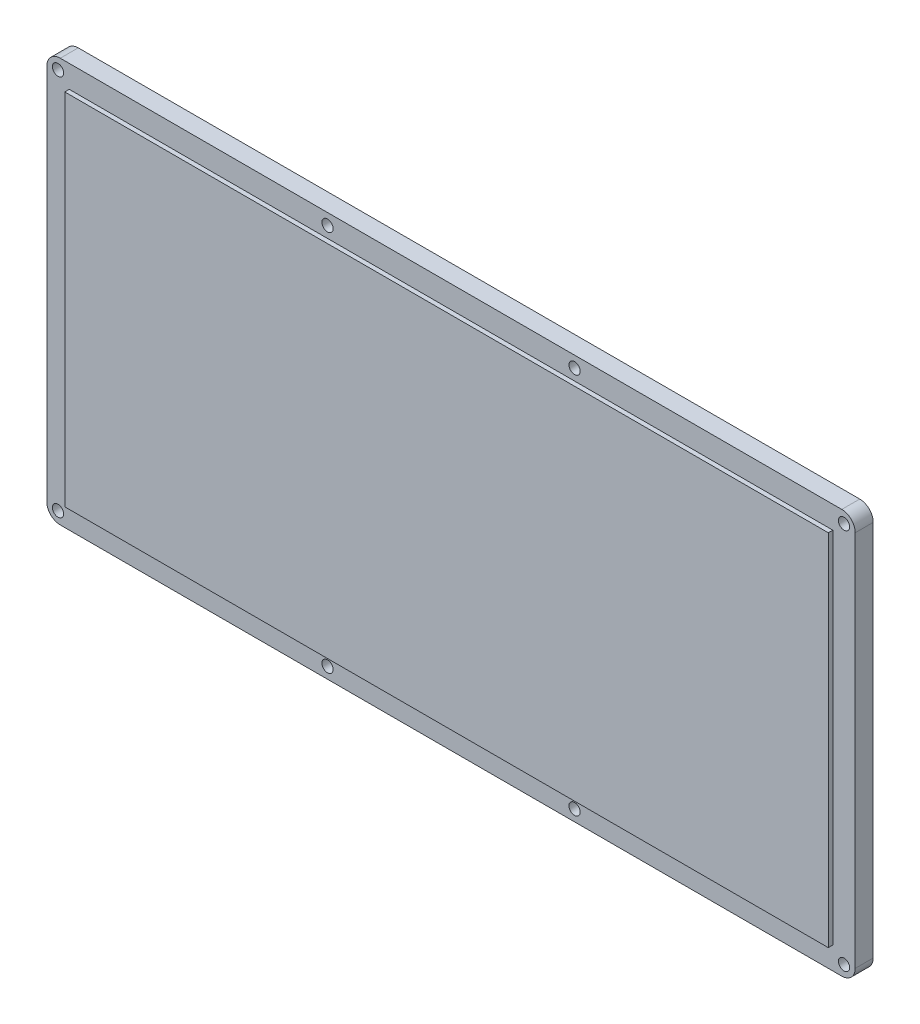
from build123d import *

# Parameters (mm, degrees)
SKETCH1_W           = 180
SKETCH1_H           = 90
BOSS_EXTRUDE1_DEPTH = 4
FILLET1_R           = 3
SKETCH2_W           = 170
SKETCH2_H           = 80
BOSS_EXTRUDE2_DEPTH = 1
SKETCH3_R           = 1.25
CUT_EXTRUDE2_DEPTH  = 10
BOSS_EXTRUDE4_DEPTH = 1


with BuildPart() as part:
    # Sketch1 → Boss-Extrude1 (new body)
    with BuildSketch(Plane.XY):
        Rectangle(SKETCH1_W, SKETCH1_H)
    extrude(amount=BOSS_EXTRUDE1_DEPTH)

    # Fillet1
    fillet1_edges = [part.edges().sort_by_distance(p)[0] for p in [
        (90, 45, 2),
        (90, -45, 2),
        (-90, -45, 2),
        (-90, 45, 2),
    ]]
    fillet(fillet1_edges, radius=FILLET1_R)

    # Sketch2 → Boss-Extrude2 (add)
    with BuildSketch(Plane.XY.offset(4)):
        Rectangle(SKETCH2_W, SKETCH2_H)
    extrude(amount=BOSS_EXTRUDE2_DEPTH)

    # Sketch3 → Cut-Extrude2 (cut)
    with BuildSketch(Plane(origin=(0, 0, 0), x_dir=(-1, 0, 0), z_dir=(0, 0, -1))):
        with Locations((-87.5, 42.5)):
            Circle(SKETCH3_R)
        with Locations((87.5, 42.5)):
            Circle(SKETCH3_R)
        with Locations((87.5, -42.5)):
            Circle(SKETCH3_R)
        with Locations((-87.5, -42.5)):
            Circle(SKETCH3_R)
        with Locations((-27.5, -42.5)):
            Circle(SKETCH3_R)
        with Locations((27.5, 42.5)):
            Circle(SKETCH3_R)
        with Locations((27.5, -42.5)):
            Circle(SKETCH3_R)
        with Locations((-27.5, 42.5)):
            Circle(SKETCH3_R)
    extrude(amount=-CUT_EXTRUDE2_DEPTH, mode=Mode.SUBTRACT)

    # Sketch4 → Boss-Extrude4 (add)
    # profile 1 of 4: a face of its own
    with BuildSketch(Plane(origin=(0, 0, 0), x_dir=(-1, 0, 0), z_dir=(0, 0, -1))):
        with BuildLine():
            add(Edge.make_bspline(
                [(71.413910742, 1.321240283), (71.413910742, 14.479292944), (60.747203687, 25.146), (47.589151025, 25.146)],
                knots=[7, 7, 7, 7, 8, 8, 8, 8], degree=3))
            Line((47.589151025, 25.146), (-47.589151025, 25.146))
            add(Edge.make_bspline(
                [(-47.589151025, 25.146), (-60.747212988, 25.146), (-71.413929346, 14.479292944), (-71.413929346, 1.321240283)],
                knots=[1, 1, 1, 1, 2, 2, 2, 2], degree=3))
            Line((-71.413929346, 1.321240283), (-71.413929346, -1.321240283))
            add(Edge.make_bspline(
                [(-71.413929346, -1.321240283), (-71.413929346, -14.479292944), (-60.747212988, -25.146), (-47.589151025, -25.146)],
                knots=[3, 3, 3, 3, 4, 4, 4, 4], degree=3))
            Line((-47.589151025, -25.146), (47.589151025, -25.146))
            add(Edge.make_bspline(
                [(47.589151025, -25.146), (60.747203687, -25.146), (71.413910742, -14.479292944), (71.413910742, -1.321240283)],
                knots=[5, 5, 5, 5, 6, 6, 6, 6], degree=3))
            Line((71.413910742, -1.321240283), (71.413910742, 1.321240283))
        make_face()
        with BuildLine():
            add(Edge.make_bspline(
                [(-22.220671582, -15.293252563), (-24.527712158, -14.433881763), (-26.450385498, -13.232969019), (-27.988114893, -11.690505029)],
                knots=[4, 4, 4, 4, 5, 5, 5, 5], degree=3))
            Line((-27.988114893, -11.690505029), (-26.793415723, -10.743102393))
            add(Edge.make_bspline(
                [(-26.793415723, -10.743102393), (-25.392775635, -12.094778027), (-23.641924365, -13.141393213), (-21.540973535, -13.883124683)],
                knots=[6, 6, 6, 6, 7, 7, 7, 7], degree=3))
            add(Edge.make_bspline(
                [(-21.540973535, -13.883124683), (-19.439948291, -14.625042188), (-17.188067139, -14.995810254), (-11.07725874, -14.995810254), (-8.166031787, -14.158410205), (-6.051332959, -12.483796143)],
                knots=[7, 7, 7, 7, 8, 8, 9.542738152, 9.542738152, 9.542738152, 9.542738152], degree=3))
            add(Edge.make_bspline(
                [(-6.051332959, -12.483796143), (-3.936820166, -10.808986743), (-2.879135889, -8.715765674), (-2.879135889, -3.545058032), (-3.785461963, -1.436944849), (-5.598095508, 0.12022522)],
                knots=[9, 9, 9, 9, 10, 10, 11.05839116, 11.05839116, 11.05839116, 11.05839116], degree=3))
            add(Edge.make_bspline(
                [(-5.598095508, 0.12022522), (-7.410729053, 1.677385986), (-9.992599365, 2.456157056), (-13.342943701, 2.456157056)],
                knots=[11, 11, 11, 11, 12, 12, 12, 12], degree=3))
            Line((-13.342943701, 2.456157056), (-15.691135254, 2.456157056))
            add(Edge.make_bspline(
                [(-15.691135254, 2.456157056), (-19.701030029, 2.456157056), (-21.705744873, 3.756096313), (-21.705744873, 7.531382153), (-21.08459209, 8.497211572), (-19.841598193, 9.254021191)],
                knots=[13, 13, 13, 13, 14, 14, 14.451898277, 14.451898277, 14.451898277, 14.451898277], degree=3))
            add(Edge.make_bspline(
                [(-19.841598193, 9.254021191), (-18.598957764, 10.01045874), (-16.734922705, 10.388668213), (-12.505525049, 10.388668213), (-10.884972803, 10.171825635), (-9.388133936, 9.738707886)],
                knots=[15, 15, 15, 15, 16, 16, 16.701523815, 16.701523815, 16.701523815, 16.701523815], degree=3))
            add(Edge.make_bspline(
                [(-9.388133936, 9.738707886), (-7.891648535, 9.305208765), (-6.655798389, 8.684465259), (-5.680564893, 7.876654102)],
                knots=[17, 17, 17, 17, 18, 18, 18, 18], degree=3))
            Line((-5.680564893, 7.876654102), (-6.854669971, 6.907290015))
            add(Edge.make_bspline(
                [(-6.854669971, 6.907290015), (-8.571253564, 8.170366406), (-11.035996143, 8.802095288), (-16.309069629, 8.802095288), (-17.819842529, 8.574267334), (-18.780862939, 8.118992798)],
                knots=[19, 19, 19, 19, 20, 20, 20.641028462, 20.641028462, 20.641028462, 20.641028462], degree=3))
            add(Edge.make_bspline(
                [(-18.780862939, 8.118992798), (-19.742181006, 7.663718262), (-20.222728418, 7.075921582), (-20.222728418, 5.518937549), (-19.886395459, 4.923876196), (-19.213413281, 4.571348877)],
                knots=[21, 21, 21, 21, 22, 22, 23.163728025, 23.163728025, 23.163728025, 23.163728025], degree=3))
            add(Edge.make_bspline(
                [(-19.213413281, 4.571348877), (-18.540765967, 4.218812256), (-17.366660889, 4.042553247), (-15.691135254, 4.042553247)],
                knots=[23, 23, 23, 23, 24, 24, 24, 24], degree=3))
            Line((-15.691135254, 4.042553247), (-13.342943701, 4.042553247))
            add(Edge.make_bspline(
                [(-13.342943701, 4.042553247), (-9.525595313, 4.042553247), (-6.580100684, 3.113205322), (-4.506478418, 1.255244312)],
                knots=[25, 25, 25, 25, 26, 26, 26, 26], degree=3))
            add(Edge.make_bspline(
                [(-4.506478418, 1.255244312), (-2.433209619, -0.603451538), (-1.396212451, -3.089597461), (-1.396212451, -7.628762256), (-1.691654883, -8.965741113), (-2.281814209, -10.214120728)],
                knots=[26, 26, 26, 26, 27, 27, 27.457591579, 27.457591579, 27.457591579, 27.457591579], degree=3))
            add(Edge.make_bspline(
                [(-2.281814209, -10.214120728), (-2.872364209, -11.46286311), (-3.7205729, -12.560851904), (-4.825751953, -13.508254541)],
                knots=[0, 0, 0, 0, 1, 1, 1, 1], degree=3))
            add(Edge.make_bspline(
                [(-4.825751953, -13.508254541), (-5.931284473, -14.456029248), (-7.342193701, -15.205025391), (-9.05859126, -15.755968506)],
                knots=[1, 1, 1, 1, 2, 2, 2, 2], degree=3))
            add(Edge.make_bspline(
                [(-9.05859126, -15.755968506), (-10.775360889, -16.306911621), (-12.683876953, -16.58239248), (-17.435233447, -16.58239248), (-19.913724023, -16.152614063), (-22.220671582, -15.293252563)],
                knots=[2, 2, 2, 2, 3, 3, 4.261526746, 4.261526746, 4.261526746, 4.261526746], degree=3))
        make_face(mode=Mode.SUBTRACT)
        with BuildLine():
            add(Edge.make_bspline(
                [(-35.073896338, 11.801456396), (-33.618468896, 10.345675488), (-32.457944385, 8.611846436), (-31.592769287, 6.600341309)],
                knots=[13, 13, 13, 13, 14, 14, 14, 14], degree=3))
            add(Edge.make_bspline(
                [(-31.592769287, 6.600341309), (-30.727705811, 4.588482715), (-30.295155469, 2.477281348), (-30.295155469, 0.266551172), (-30.295155469, -1.944532471), (-30.727705811, -4.055910571), (-31.592769287, -6.067415698)],
                knots=[14, 14, 14, 14, 15, 15, 15, 16, 16, 16, 16], degree=3))
            add(Edge.make_bspline(
                [(-31.592769287, -6.067415698), (-32.457944385, -8.079274292), (-33.618468896, -9.813094043), (-35.073896338, -11.268354053)],
                knots=[0, 0, 0, 0, 1, 1, 1, 1], degree=3))
            add(Edge.make_bspline(
                [(-35.073896338, -11.268354053), (-36.529602832, -12.724134961), (-38.263320264, -13.884482739), (-40.274843994, -14.749564819)],
                knots=[1, 1, 1, 1, 2, 2, 2, 2], degree=3))
            add(Edge.make_bspline(
                [(-40.274843994, -14.749564819), (-42.286702588, -15.614646899), (-44.397996973, -16.047187939), (-46.608727148, -16.047187939), (-48.819810791, -16.047187939), (-50.931086572, -15.614646899), (-52.942610303, -14.749564819)],
                knots=[2, 2, 2, 2, 3, 3, 3, 4, 4, 4, 4], degree=3))
            add(Edge.make_bspline(
                [(-52.942610303, -14.749564819), (-54.954468896, -13.884482739), (-56.688204932, -12.724134961), (-58.143632373, -11.268354053)],
                knots=[4, 4, 4, 4, 5, 5, 5, 5], degree=3))
            add(Edge.make_bspline(
                [(-58.143632373, -11.268354053), (-59.599320264, -9.813094043), (-60.759584326, -8.079274292), (-61.624666406, -6.067415698)],
                knots=[5, 5, 5, 5, 6, 6, 6, 6], degree=3))
            add(Edge.make_bspline(
                [(-61.624666406, -6.067415698), (-62.489748486, -4.055910571), (-62.922373242, -1.944532471), (-62.922373242, 0.266551172), (-62.922373242, 2.477281348), (-62.489748486, 4.588482715), (-61.624666406, 6.600341309)],
                knots=[6, 6, 6, 6, 7, 7, 7, 8, 8, 8, 8], degree=3))
            add(Edge.make_bspline(
                [(-61.624666406, 6.600341309), (-60.759584326, 8.611846436), (-59.599320264, 10.345675488), (-58.143632373, 11.801456396)],
                knots=[8, 8, 8, 8, 9, 9, 9, 9], degree=3))
            add(Edge.make_bspline(
                [(-58.143632373, 11.801456396), (-56.688204932, 13.256707104), (-54.954468896, 14.417231616), (-52.942610303, 15.282313696)],
                knots=[9, 9, 9, 9, 10, 10, 10, 10], degree=3))
            add(Edge.make_bspline(
                [(-52.942610303, 15.282313696), (-50.931086572, 16.147395776), (-48.819810791, 16.579936816), (-46.608727148, 16.579936816), (-44.397996973, 16.579936816), (-42.286702588, 16.147395776), (-40.274843994, 15.282313696)],
                knots=[10, 10, 10, 10, 11, 11, 11, 12, 12, 12, 12], degree=3))
            add(Edge.make_bspline(
                [(-40.274843994, 15.282313696), (-38.263320264, 14.417231616), (-36.529602832, 13.256707104), (-35.073896338, 11.801456396)],
                knots=[12, 12, 12, 12, 13, 13, 13, 13], degree=3))
        make_face(mode=Mode.SUBTRACT)
        with BuildLine():
            add(Edge.make_bspline(
                [(-7.730002588, -2.138288086), (-8.986558447, -1.190885449), (-10.857662842, -0.716988794), (-13.342943701, -0.716988794)],
                knots=[0, 0, 0, 0, 1, 1, 1, 1], degree=3))
            Line((-13.342943701, -0.716988794), (-15.691135254, -0.716988794))
            add(Edge.make_bspline(
                [(-15.691135254, -0.716988794), (-18.574866211, -0.716988794), (-20.792647119, -0.088989917), (-22.344291943, 1.167017139)],
                knots=[2, 2, 2, 2, 3, 3, 3, 3], degree=3))
            add(Edge.make_bspline(
                [(-22.344291943, 1.167017139), (-23.896197217, 2.423033496), (-24.671852197, 4.15274187), (-24.671852197, 8.412714404), (-23.758754443, 10.127716699), (-21.9323729, 11.501363086)],
                knots=[3, 3, 3, 3, 4, 4, 4.933191502, 4.933191502, 4.933191502, 4.933191502], degree=3))
            add(Edge.make_bspline(
                [(-21.9323729, 11.501363086), (-20.106158789, 12.875000171), (-17.544919775, 13.561823364), (-12.052287598, 13.561823364), (-10.002849902, 13.238512866), (-8.100770654, 12.592087207)],
                knots=[5, 5, 5, 5, 6, 6, 6.666630916, 6.666630916, 6.666630916, 6.666630916], degree=3))
            add(Edge.make_bspline(
                [(-8.100770654, 12.592087207), (-6.199063477, 11.945652246), (-4.616443799, 11.034917139), (-3.352930225, 9.859872583)],
                knots=[7, 7, 7, 7, 8, 8, 8, 8], degree=3))
            Line((-3.352930225, 9.859872583), (-4.506478418, 8.868361011))
            add(Edge.make_bspline(
                [(-4.506478418, 8.868361011), (-5.632549219, 9.852245142), (-7.047104736, 10.616310132), (-8.749586865, 11.159997876)],
                knots=[9, 9, 9, 9, 10, 10, 10, 10], degree=3))
            add(Edge.make_bspline(
                [(-8.749586865, 11.159997876), (-10.452441064, 11.703127515), (-12.285780322, 11.975250439), (-17.146841748, 11.975250439), (-19.361125195, 11.446268774), (-20.892175928, 10.388668213)],
                knots=[10, 10, 10, 10, 11, 11, 12.475725764, 12.475725764, 12.475725764, 12.475725764], degree=3))
            add(Edge.make_bspline(
                [(-20.892175928, 10.388668213), (-22.423468506, 9.331076953), (-23.188854346, 7.986842725), (-23.188854346, 4.593496362), (-22.560557812, 3.238276758), (-21.304094971, 2.290874121)],
                knots=[12, 12, 12, 12, 13, 13, 14.081162645, 14.081162645, 14.081162645, 14.081162645], degree=3))
            add(Edge.make_bspline(
                [(-21.304094971, 2.290874121), (-20.047613525, 1.343285449), (-18.17676958, 0.869584131), (-15.691135254, 0.869584131)],
                knots=[14, 14, 14, 14, 15, 15, 15, 15], degree=3))
            Line((-15.691135254, 0.869584131), (-13.425431689, 0.869584131))
            add(Edge.make_bspline(
                [(-13.425431689, 0.869584131), (-10.500475342, 0.869584131), (-8.258751709, 0.241575952), (-6.70014917, -1.014431104)],
                knots=[16, 16, 16, 16, 17, 17, 17, 17], degree=3))
            add(Edge.make_bspline(
                [(-6.70014917, -1.014431104), (-5.141714063, -2.270438159), (-4.362245361, -4.000332568), (-4.362245361, -8.260491138), (-5.275677979, -9.975502734), (-7.101724658, -11.348953784)],
                knots=[17, 17, 17, 17, 18, 18, 18.933430991, 18.933430991, 18.933430991, 18.933430991], degree=3))
            add(Edge.make_bspline(
                [(-7.101724658, -11.348953784), (-8.928292236, -12.722786206), (-11.489084766, -13.409237329), (-16.982051807, -13.409237329), (-19.031601123, -13.086298901), (-20.933308301, -12.439677905)],
                knots=[19, 19, 19, 19, 20, 20, 20.666685482, 20.666685482, 20.666685482, 20.666685482], degree=3))
            add(Edge.make_bspline(
                [(-20.933308301, -12.439677905), (-22.835387549, -11.793438281), (-24.417914209, -10.882703174), (-25.681167334, -9.707472583)],
                knots=[21, 21, 21, 21, 22, 22, 22, 22], degree=3))
            Line((-25.681167334, -9.707472583), (-24.527712158, -8.715765674))
            add(Edge.make_bspline(
                [(-24.527712158, -8.715765674), (-23.401901807, -9.700021875), (-21.987346289, -10.464086865), (-20.284510693, -11.007402539)],
                knots=[23, 23, 23, 23, 24, 24, 24, 24], degree=3))
            add(Edge.make_bspline(
                [(-20.284510693, -11.007402539), (-18.581916943, -11.551090283), (-16.748745117, -11.822655103), (-11.88751626, -11.822655103), (-9.67332583, -11.293859473), (-8.142014648, -10.236082178)],
                knots=[24, 24, 24, 24, 25, 25, 26.475271628, 26.475271628, 26.475271628, 26.475271628], degree=3))
            add(Edge.make_bspline(
                [(-8.142014648, -10.236082178), (-6.610889502, -9.178490918), (-5.84533623, -7.834256689), (-5.84533623, -4.440910327), (-6.47361416, -3.085690723), (-7.730002588, -2.138288086)],
                knots=[26, 26, 26, 26, 27, 27, 28.081162645, 28.081162645, 28.081162645, 28.081162645], degree=3))
        make_face(mode=Mode.SUBTRACT)
        with BuildLine():
            add(Edge.make_bspline(
                [(-23.435983447, 0.032184082), (-21.623368506, -1.525172021), (-19.04185166, -2.303571021), (-15.691135254, -2.303571021)],
                knots=[5, 5, 5, 5, 6, 6, 6, 6], degree=3))
            Line((-15.691135254, -2.303571021), (-13.425431689, -2.303571021))
            add(Edge.make_bspline(
                [(-13.425431689, -2.303571021), (-9.360823975, -2.303571021), (-7.3284271, -3.603500977), (-7.3284271, -7.379168188), (-7.949747314, -8.344997607), (-9.192387744, -9.101425854)],
                knots=[7, 7, 7, 7, 8, 8, 8.45203975, 8.45203975, 8.45203975, 8.45203975], degree=3))
            add(Edge.make_bspline(
                [(-9.192387744, -9.101425854), (-10.435400244, -9.858235474), (-12.29952832, -10.236082178), (-16.528907373, -10.236082178), (-18.149366602, -10.01961167), (-19.645963623, -9.586112549)],
                knots=[9, 9, 9, 9, 10, 10, 10.701758326, 10.701758326, 10.701758326, 10.701758326], degree=3))
            add(Edge.make_bspline(
                [(-19.645963623, -9.586112549), (-21.142876904, -9.152985498), (-22.378745654, -8.532241992), (-23.35360708, -7.724068066)],
                knots=[11, 11, 11, 11, 12, 12, 12, 12], degree=3))
            Line((-23.35360708, -7.724068066), (-22.179520605, -6.754694678))
            add(Edge.make_bspline(
                [(-22.179520605, -6.754694678), (-20.463104443, -8.018152441), (-17.998082813, -8.649695288), (-12.724934912, -8.649695288), (-11.214701514, -8.422053369), (-10.253234619, -7.966592798)],
                knots=[13, 13, 13, 13, 14, 14, 14.641061121, 14.641061121, 14.641061121, 14.641061121], degree=3))
            add(Edge.make_bspline(
                [(-10.253234619, -7.966592798), (-9.29227002, -7.511504297), (-8.811350537, -6.923698315), (-8.811350537, -5.366537549), (-9.148036963, -4.771476196), (-9.820684277, -4.418939575)],
                knots=[15, 15, 15, 15, 16, 16, 17.162883241, 17.162883241, 17.162883241, 17.162883241], degree=3))
            add(Edge.make_bspline(
                [(-9.820684277, -4.418939575), (-10.493666455, -4.066226221), (-11.667771533, -3.890143945), (-13.342943701, -3.890143945)],
                knots=[17, 17, 17, 17, 18, 18, 18, 18], degree=3))
            Line((-13.342943701, -3.890143945), (-15.691135254, -3.890143945))
            add(Edge.make_bspline(
                [(-15.691135254, -3.890143945), (-19.508855713, -3.890143945), (-22.454350342, -2.961168091), (-24.527712158, -1.102658276)],
                knots=[19, 19, 19, 19, 20, 20, 20, 20], degree=3))
            add(Edge.make_bspline(
                [(-24.527712158, -1.102658276), (-26.601334424, 0.755674805), (-27.637959521, 3.241634692), (-27.637959521, 7.780985522), (-27.342870557, 9.117769043), (-26.752264746, 10.366706763)],
                knots=[20, 20, 20, 20, 21, 21, 21.457394483, 21.457394483, 21.457394483, 21.457394483], degree=3))
            add(Edge.make_bspline(
                [(-26.752264746, 10.366706763), (-26.161993799, 11.615086377), (-25.313971143, 12.713437939), (-24.208438623, 13.660840576)],
                knots=[22, 22, 22, 22, 23, 23, 23, 23], degree=3))
            add(Edge.make_bspline(
                [(-24.208438623, 13.660840576), (-23.103147949, 14.60843855), (-21.692257324, 15.357611426), (-19.975487695, 15.908554541)],
                knots=[23, 23, 23, 23, 24, 24, 24, 24], degree=3))
            add(Edge.make_bspline(
                [(-19.975487695, 15.908554541), (-18.259145947, 16.459506958), (-16.350313623, 16.73479248), (-11.599217578, 16.73479248), (-9.120354932, 16.305014062), (-6.813425977, 15.445838599)],
                knots=[24, 24, 24, 24, 25, 25, 26.261302662, 26.261302662, 26.261302662, 26.261302662], degree=3))
            add(Edge.make_bspline(
                [(-6.813425977, 15.445838599), (-4.506478418, 14.586281763), (-2.584046924, 13.385369019), (-1.045982666, 11.843100366)],
                knots=[26, 26, 26, 26, 27, 27, 27, 27], degree=3))
            Line((-1.045982666, 11.843100366), (-2.240588818, 10.895502393))
            add(Edge.make_bspline(
                [(-2.240588818, 10.895502393), (-3.641396338, 12.247001294), (-5.392098779, 13.293421143), (-7.493217041, 14.035524683)],
                knots=[0, 0, 0, 0, 1, 1, 1, 1], degree=3))
            add(Edge.make_bspline(
                [(-7.493217041, 14.035524683), (-9.594149268, 14.777256152), (-11.846458301, 15.148396289), (-17.956931836, 15.148396289), (-20.868326221, 14.31099624), (-22.982839014, 12.636382178)],
                knots=[1, 1, 1, 1, 2, 2, 3.543051588, 3.543051588, 3.543051588, 3.543051588], degree=3))
            add(Edge.make_bspline(
                [(-22.982839014, 12.636382178), (-25.097612256, 10.96158208), (-26.154868652, 8.868361011), (-26.154868652, 3.697281299), (-25.248635596, 1.589168115), (-23.435983447, 0.032184082)],
                knots=[3, 3, 3, 3, 4, 4, 5.058531654, 5.058531654, 5.058531654, 5.058531654], degree=3))
        make_face(mode=Mode.SUBTRACT)
        with BuildLine():
            add(Edge.make_bspline(
                [(23.826024756, -13.080996899), (25.837548486, -12.092378174), (27.536905225, -10.739949097), (28.924150781, -9.023179468)],
                knots=[10, 10, 10, 10, 11, 11, 11, 11], degree=3))
            Line((28.924150781, -9.023179468), (30.098237256, -9.929672974))
            add(Edge.make_bspline(
                [(30.098237256, -9.929672974), (28.573902393, -11.824431738), (26.702630566, -13.317968481), (24.485296143, -14.409585571)],
                knots=[12, 12, 12, 12, 13, 13, 13, 13], degree=3))
            add(Edge.make_bspline(
                [(24.485296143, -14.409585571), (22.267422217, -15.501211963), (19.895064697, -16.047187939), (15.157456201, -16.047187939), (13.046254834, -15.614646899), (11.034731104, -14.749564819)],
                knots=[13, 13, 13, 13, 14, 14, 14.875148186, 14.875148186, 14.875148186, 14.875148186], degree=3))
            add(Edge.make_bspline(
                [(11.034731104, -14.749564819), (9.022891113, -13.884482739), (7.289062061, -12.724134961), (5.833802051, -11.268354053)],
                knots=[15, 15, 15, 15, 16, 16, 16, 16], degree=3))
            add(Edge.make_bspline(
                [(5.833802051, -11.268354053), (4.378021143, -9.813094043), (3.217850098, -8.079274292), (2.352581982, -6.067415698)],
                knots=[16, 16, 16, 16, 17, 17, 17, 17], degree=3))
            add(Edge.make_bspline(
                [(2.352581982, -6.067415698), (1.487518506, -4.055910571), (1.054968164, -1.944532471), (1.054968164, 2.477281348), (1.487518506, 4.588482715), (2.352581982, 6.600341309)],
                knots=[17, 17, 17, 17, 18, 18, 18.999840139, 18.999840139, 18.999840139, 18.999840139], degree=3))
            add(Edge.make_bspline(
                [(2.352581982, 6.600341309), (3.217850098, 8.611846436), (4.378021143, 10.345675488), (5.833802051, 11.801456396)],
                knots=[19, 19, 19, 19, 20, 20, 20, 20], degree=3))
            add(Edge.make_bspline(
                [(5.833802051, 11.801456396), (7.289062061, 13.256707104), (9.022891113, 14.417231616), (11.034731104, 15.282313696)],
                knots=[20, 20, 20, 20, 21, 21, 21, 21], degree=3))
            add(Edge.make_bspline(
                [(11.034731104, 15.282313696), (13.046254834, 16.147395776), (15.157456201, 16.579936816), (19.895064697, 16.579936816), (22.270919678, 16.034305005), (24.495565283, 14.942511182)],
                knots=[21, 21, 21, 21, 22, 22, 23.142663626, 23.142663626, 23.142663626, 23.142663626], degree=3))
            add(Edge.make_bspline(
                [(24.495565283, 14.942511182), (26.720024854, 13.850717358), (28.594440674, 12.350390332), (30.118775537, 10.441883569)],
                knots=[23, 23, 23, 23, 24, 24, 24, 24], degree=3))
            Line((30.118775537, 10.441883569), (28.924150781, 9.556095776))
            add(Edge.make_bspline(
                [(28.924150781, 9.556095776), (27.536905225, 11.27252124), (25.837548486, 12.625127051), (23.826024756, 13.613913208)],
                knots=[25, 25, 25, 25, 26, 26, 26, 26], degree=3))
            add(Edge.make_bspline(
                [(23.826024756, 13.613913208), (21.814184766, 14.602708667), (19.661739404, 15.097013379), (15.363471533, 15.097013379), (13.444704932, 14.705707031), (11.611514502, 13.922926904)],
                knots=[0, 0, 0, 0, 1, 1, 1.874354044, 1.874354044, 1.874354044, 1.874354044], degree=3))
            add(Edge.make_bspline(
                [(11.611514502, 13.922926904), (9.778175244, 13.140137476), (8.199034424, 12.086099487), (6.873924609, 10.761157104)],
                knots=[2, 2, 2, 2, 3, 3, 3, 3], degree=3))
            add(Edge.make_bspline(
                [(6.873924609, 10.761157104), (5.54862876, 9.435870557), (4.494944238, 7.856729736), (3.712164111, 6.02355791)],
                knots=[3, 3, 3, 3, 4, 4, 4, 4], degree=3))
            add(Edge.make_bspline(
                [(3.712164111, 6.02355791), (2.929365381, 4.190395386), (2.538059033, 2.271275317), (2.538059033, -1.73852644), (2.929365381, -3.657469775), (3.712164111, -5.490641602)],
                knots=[4, 4, 4, 4, 5, 5, 6.000176317, 6.000176317, 6.000176317, 6.000176317], degree=3))
            add(Edge.make_bspline(
                [(3.712164111, -5.490641602), (4.494944238, -7.323980859), (5.54862876, -8.90312168), (6.873924609, -10.228240796)],
                knots=[6, 6, 6, 6, 7, 7, 7, 7], degree=3))
            add(Edge.make_bspline(
                [(6.873924609, -10.228240796), (8.199034424, -11.553527344), (9.778175244, -12.607388599), (11.611514502, -13.390001294)],
                knots=[7, 7, 7, 7, 8, 8, 8, 8], degree=3))
            add(Edge.make_bspline(
                [(11.611514502, -13.390001294), (13.444704932, -14.172613989), (15.363471533, -14.56409707), (19.661739404, -14.56409707), (21.814184766, -14.069783057), (23.826024756, -13.080996899)],
                knots=[8, 8, 8, 8, 9, 9, 10.143701463, 10.143701463, 10.143701463, 10.143701463], degree=3))
        make_face(mode=Mode.SUBTRACT)
        with BuildLine():
            add(Edge.make_bspline(
                [(22.559385791, -10.403271973), (24.179417139, -9.607088013), (25.545938379, -8.515470923), (26.658261182, -7.12824397)],
                knots=[10, 10, 10, 10, 11, 11, 11, 11], degree=3))
            Line((26.658261182, -7.12824397), (27.770583984, -8.096324414))
            add(Edge.make_bspline(
                [(27.770583984, -8.096324414), (26.520818408, -9.648155273), (24.989860693, -10.866787866), (23.177227148, -11.752398926)],
                knots=[12, 12, 12, 12, 13, 13, 13, 13], degree=3))
            add(Edge.make_bspline(
                [(23.177227148, -11.752398926), (21.364593604, -12.638186719), (19.428414111, -13.080996899), (15.555906299, -13.080996899), (13.825742139, -12.72762312), (12.177861328, -12.020345361)],
                knots=[13, 13, 13, 13, 14, 14, 14.879972906, 14.879972906, 14.879972906, 14.879972906], degree=3))
            add(Edge.make_bspline(
                [(12.177861328, -12.020345361), (10.529999121, -11.313244336), (9.11198335, -10.365692871), (7.92448374, -9.177681665)],
                knots=[15, 15, 15, 15, 16, 16, 16, 16], degree=3))
            add(Edge.make_bspline(
                [(7.92448374, -9.177681665), (6.736463232, -7.990014624), (5.788911768, -6.571989551), (5.081978174, -4.924294775)],
                knots=[16, 16, 16, 16, 17, 17, 17, 17], degree=3))
            add(Edge.make_bspline(
                [(5.081978174, -4.924294775), (4.374542285, -3.276432568), (4.021168506, -1.546091675), (4.021168506, 2.079184717), (4.374542285, 3.809348877), (5.081978174, 5.457043652)],
                knots=[17, 17, 17, 17, 18, 18, 18.999994868, 18.999994868, 18.999994868, 18.999994868], degree=3))
            add(Edge.make_bspline(
                [(5.081978174, 5.457043652), (5.788911768, 7.105091895), (6.736463232, 8.522763501), (7.92448374, 9.710607275)],
                knots=[19, 19, 19, 19, 20, 20, 20, 20], degree=3))
            add(Edge.make_bspline(
                [(7.92448374, 9.710607275), (9.11198335, 10.898265015), (10.529999121, 11.845649048), (12.177861328, 12.553094238)],
                knots=[20, 20, 20, 20, 21, 21, 21, 21], degree=3))
            add(Edge.make_bspline(
                [(12.177861328, 12.553094238), (13.825742139, 13.260195264), (15.555906299, 13.613913208), (19.441994678, 13.613913208), (21.388424707, 13.16762417), (23.208202002, 12.275055396)],
                knots=[21, 21, 21, 21, 22, 22, 23.143890799, 23.143890799, 23.143890799, 23.143890799], degree=3))
            add(Edge.make_bspline(
                [(23.208202002, 12.275055396), (25.027439795, 11.382309888), (26.562043799, 10.153408154), (27.811827979, 8.588015332)],
                knots=[23, 23, 23, 23, 24, 24, 24, 24], degree=3))
            Line((27.811827979, 8.588015332), (26.658261182, 7.661160278))
            add(Edge.make_bspline(
                [(26.658261182, 7.661160278), (25.545938379, 9.047875635), (24.179417139, 10.139669458), (22.559385791, 10.936197583)],
                knots=[25, 25, 25, 25, 26, 26, 26, 26], degree=3))
            add(Edge.make_bspline(
                [(22.559385791, 10.936197583), (20.938833545, 11.732548975), (19.208669385, 12.130989771), (15.761903027, 12.130989771), (14.227466455, 11.818506519), (12.764913867, 11.193707446)],
                knots=[0, 0, 0, 0, 1, 1, 1.873110713, 1.873110713, 1.873110713, 1.873110713], degree=3))
            add(Edge.make_bspline(
                [(12.764913867, 11.193707446), (11.302510107, 10.568554907), (10.038996533, 9.72417854), (8.974875439, 8.660224878)],
                knots=[2, 2, 2, 2, 3, 3, 3, 3], degree=3))
            add(Edge.make_bspline(
                [(8.974875439, 8.660224878), (7.910568311, 7.595741016), (7.066005908, 6.332571606), (6.441374268, 4.870000415)],
                knots=[3, 3, 3, 3, 4, 4, 4, 4], degree=3))
            add(Edge.make_bspline(
                [(6.441374268, 4.870000415), (5.816407764, 3.407605957), (5.504091943, 1.873178687), (5.504091943, -1.340085645), (5.816407764, -2.874680347), (6.441374268, -4.337251538)],
                knots=[4, 4, 4, 4, 5, 5, 6.00000579, 6.00000579, 6.00000579, 6.00000579], degree=3))
            add(Edge.make_bspline(
                [(6.441374268, -4.337251538), (7.066005908, -5.799645996), (7.910568311, -7.063168872), (8.974875439, -8.127122534)],
                knots=[6, 6, 6, 6, 7, 7, 7, 7], degree=3))
            add(Edge.make_bspline(
                [(8.974875439, -8.127122534), (10.038996533, -9.191597095), (11.302510107, -10.036150195), (12.764913867, -10.660781836)],
                knots=[7, 7, 7, 7, 8, 8, 8, 8], degree=3))
            add(Edge.make_bspline(
                [(12.764913867, -10.660781836), (14.227466455, -11.285757642), (15.761903027, -11.597896729), (19.208669385, -11.597896729), (20.938833545, -11.199800098), (22.559385791, -10.403271973)],
                knots=[8, 8, 8, 8, 9, 9, 10.145330122, 10.145330122, 10.145330122, 10.145330122], degree=3))
        make_face(mode=Mode.SUBTRACT)
        with BuildLine():
            add(Edge.make_bspline(
                [(21.261585938, -7.73599292), (22.483706689, -7.138503809), (23.506751221, -6.318135278), (24.330775342, -5.274366431)],
                knots=[2, 2, 2, 2, 3, 3, 3, 3], degree=3))
            Line((24.330775342, -5.274366431), (25.463636426, -6.221917896))
            add(Edge.make_bspline(
                [(25.463636426, -6.221917896), (24.502336963, -7.430467383), (23.314335059, -8.381497705), (21.900133008, -9.074673999)],
                knots=[4, 4, 4, 4, 5, 5, 5, 5], degree=3))
            add(Edge.make_bspline(
                [(21.900133008, -9.074673999), (20.48557749, -9.76820376), (18.975158057, -10.114973291), (15.487184912, -10.114973291), (13.750044434, -9.651457397), (12.15734165, -8.724611646)],
                knots=[5, 5, 5, 5, 6, 6, 7.171003115, 7.171003115, 7.171003115, 7.171003115], degree=3))
            add(Edge.make_bspline(
                [(12.15734165, -8.724611646), (10.5642854, -7.79758916), (9.304566943, -6.537889307), (8.37755376, -4.944833057)],
                knots=[7, 7, 7, 7, 8, 8, 8, 8], degree=3))
            add(Edge.make_bspline(
                [(8.37755376, -4.944833057), (7.450708008, -3.35211167), (6.987201416, -1.614989795), (6.987201416, 2.147738672), (7.450708008, 3.884516382), (8.37755376, 5.477749365)],
                knots=[8, 8, 8, 8, 9, 9, 9.99981214, 9.99981214, 9.99981214, 9.99981214], degree=3))
            add(Edge.make_bspline(
                [(8.37755376, 5.477749365), (9.304566943, 7.070638184), (10.5642854, 8.330682202), (12.15734165, 9.257360522)],
                knots=[10, 10, 10, 10, 11, 11, 11, 11], degree=3))
            add(Edge.make_bspline(
                [(12.15734165, 9.257360522), (13.750044434, 10.184383008), (15.487184912, 10.6478896), (18.975158057, 10.6478896), (20.489242383, 10.300952637), (21.910383545, 9.607599609)],
                knots=[11, 11, 11, 11, 12, 12, 12.853968693, 12.853968693, 12.853968693, 12.853968693], degree=3))
            add(Edge.make_bspline(
                [(21.910383545, 9.607599609), (23.331729346, 8.914069849), (24.522875244, 7.956249243), (25.484174707, 6.734137793)],
                knots=[13, 13, 13, 13, 14, 14, 14, 14], degree=3))
            Line((25.484174707, 6.734137793), (24.310088232, 5.827997754))
            add(Edge.make_bspline(
                [(24.310088232, 5.827997754), (23.486231543, 6.871245703), (22.466647266, 7.688479541), (21.251316797, 8.279178369)],
                knots=[15, 15, 15, 15, 16, 16, 16, 16], degree=3))
            add(Edge.make_bspline(
                [(21.251316797, 8.279178369), (20.036004932, 8.869356299), (18.741683936, 9.16479873), (14.910401514, 9.16479873), (12.812929541, 8.2925729), (11.075993701, 6.548837476)],
                knots=[16, 16, 16, 16, 17, 17, 18.790153229, 18.790153229, 18.790153229, 18.790153229], degree=3))
            add(Edge.make_bspline(
                [(11.075993701, 6.548837476), (9.338685791, 4.804757886), (8.470292285, 2.710429907), (8.470292285, -2.178025195), (9.338685791, -4.27217644), (11.075993701, -6.015921167)],
                knots=[18, 18, 18, 18, 19, 19, 20.000285461, 20.000285461, 20.000285461, 20.000285461], degree=3))
            add(Edge.make_bspline(
                [(11.075993701, -6.015921167), (12.812929541, -7.760000757), (14.910401514, -8.63187312), (18.741683936, -8.63187312), (20.039297754, -8.333128564), (21.261585938, -7.73599292)],
                knots=[0, 0, 0, 0, 1, 1, 1.558611399, 1.558611399, 1.558611399, 1.558611399], degree=3))
        make_face(mode=Mode.SUBTRACT)
        with BuildLine():
            add(Edge.make_bspline(
                [(54.908304272, -13.080996899), (56.919818701, -12.092378174), (58.619184741, -10.739949097), (60.006411694, -9.023179468)],
                knots=[10, 10, 10, 10, 11, 11, 11, 11], degree=3))
            Line((60.006411694, -9.023179468), (61.180507471, -9.929672974))
            add(Edge.make_bspline(
                [(61.180507471, -9.929672974), (59.656172607, -11.824431738), (57.784900781, -13.317968481), (55.567557056, -14.409585571)],
                knots=[12, 12, 12, 12, 13, 13, 13, 13], degree=3))
            add(Edge.make_bspline(
                [(55.567557056, -14.409585571), (53.349692432, -15.501211963), (50.97732561, -16.047187939), (46.239726416, -16.047187939), (44.128525049, -15.614646899), (42.11701062, -14.749564819)],
                knots=[13, 13, 13, 13, 14, 14, 14.875144504, 14.875144504, 14.875144504, 14.875144504], degree=3))
            add(Edge.make_bspline(
                [(42.11701062, -14.749564819), (40.105152026, -13.884482739), (38.371332275, -12.724134961), (36.916072266, -11.268354053)],
                knots=[15, 15, 15, 15, 16, 16, 16, 16], degree=3))
            add(Edge.make_bspline(
                [(36.916072266, -11.268354053), (35.460291357, -9.813094043), (34.300120313, -8.079274292), (33.434852197, -6.067415698)],
                knots=[16, 16, 16, 16, 17, 17, 17, 17], degree=3))
            add(Edge.make_bspline(
                [(33.434852197, -6.067415698), (32.569788721, -4.055910571), (32.137238379, -1.944532471), (32.137238379, 2.477281348), (32.569788721, 4.588482715), (33.434852197, 6.600341309)],
                knots=[17, 17, 17, 17, 18, 18, 18.999840139, 18.999840139, 18.999840139, 18.999840139], degree=3))
            add(Edge.make_bspline(
                [(33.434852197, 6.600341309), (34.300120313, 8.611846436), (35.460291357, 10.345675488), (36.916072266, 11.801456396)],
                knots=[19, 19, 19, 19, 20, 20, 20, 20], degree=3))
            add(Edge.make_bspline(
                [(36.916072266, 11.801456396), (38.371332275, 13.256707104), (40.105152026, 14.417231616), (42.11701062, 15.282313696)],
                knots=[20, 20, 20, 20, 21, 21, 21, 21], degree=3))
            add(Edge.make_bspline(
                [(42.11701062, 15.282313696), (44.128525049, 16.147395776), (46.239726416, 16.579936816), (50.97732561, 16.579936816), (53.353171289, 16.034305005), (55.577826196, 14.942511182)],
                knots=[21, 21, 21, 21, 22, 22, 23.142668434, 23.142668434, 23.142668434, 23.142668434], degree=3))
            add(Edge.make_bspline(
                [(55.577826196, 14.942511182), (57.802295068, 13.850717358), (59.676701587, 12.350390332), (61.20103645, 10.441883569)],
                knots=[23, 23, 23, 23, 24, 24, 24, 24], degree=3))
            Line((61.20103645, 10.441883569), (60.006411694, 9.556095776))
            add(Edge.make_bspline(
                [(60.006411694, 9.556095776), (58.619184741, 11.27252124), (56.919818701, 12.625127051), (54.908304272, 13.613913208)],
                knots=[25, 25, 25, 25, 26, 26, 26, 26], degree=3))
            add(Edge.make_bspline(
                [(54.908304272, 13.613913208), (52.896445679, 14.602708667), (50.744009619, 15.097013379), (46.445732446, 15.097013379), (44.526956543, 14.705707031), (42.693794019, 13.922926904)],
                knots=[0, 0, 0, 0, 1, 1, 1.874350498, 1.874350498, 1.874350498, 1.874350498], degree=3))
            add(Edge.make_bspline(
                [(42.693794019, 13.922926904), (40.860445459, 13.140137476), (39.281304639, 12.086099487), (37.956194824, 10.761157104)],
                knots=[2, 2, 2, 2, 3, 3, 3, 3], degree=3))
            add(Edge.make_bspline(
                [(37.956194824, 10.761157104), (36.630898975, 9.435870557), (35.577214453, 7.856729736), (34.794434326, 6.02355791)],
                knots=[3, 3, 3, 3, 4, 4, 4, 4], degree=3))
            add(Edge.make_bspline(
                [(34.794434326, 6.02355791), (34.011635596, 4.190395386), (33.620329248, 2.271275317), (33.620329248, -1.73852644), (34.011635596, -3.657469775), (34.794434326, -5.490641602)],
                knots=[4, 4, 4, 4, 5, 5, 6.000176317, 6.000176317, 6.000176317, 6.000176317], degree=3))
            add(Edge.make_bspline(
                [(34.794434326, -5.490641602), (35.577214453, -7.323980859), (36.630898975, -8.90312168), (37.956194824, -10.228240796)],
                knots=[6, 6, 6, 6, 7, 7, 7, 7], degree=3))
            add(Edge.make_bspline(
                [(37.956194824, -10.228240796), (39.281304639, -11.553527344), (40.860445459, -12.607388599), (42.693794019, -13.390001294)],
                knots=[7, 7, 7, 7, 8, 8, 8, 8], degree=3))
            add(Edge.make_bspline(
                [(42.693794019, -13.390001294), (44.526956543, -14.172613989), (46.445732446, -14.56409707), (50.744009619, -14.56409707), (52.896445679, -14.069783057), (54.908304272, -13.080996899)],
                knots=[8, 8, 8, 8, 9, 9, 10.143706102, 10.143706102, 10.143706102, 10.143706102], degree=3))
        make_face(mode=Mode.SUBTRACT)
        with BuildLine():
            add(Edge.make_bspline(
                [(53.641646704, -10.403271973), (55.261678052, -9.607088013), (56.628208594, -8.515470923), (57.740531396, -7.12824397)],
                knots=[10, 10, 10, 10, 11, 11, 11, 11], degree=3))
            Line((57.740531396, -7.12824397), (58.852854199, -8.096324414))
            add(Edge.make_bspline(
                [(58.852854199, -8.096324414), (57.603079321, -9.648155273), (56.072130908, -10.866787866), (54.259497363, -11.752398926)],
                knots=[12, 12, 12, 12, 13, 13, 13, 13], degree=3))
            add(Edge.make_bspline(
                [(54.259497363, -11.752398926), (52.446854517, -12.638186719), (50.510684326, -13.080996899), (46.638167212, -13.080996899), (44.908003052, -12.72762312), (43.260131543, -12.020345361)],
                knots=[13, 13, 13, 13, 14, 14, 14.879968932, 14.879968932, 14.879968932, 14.879968932], degree=3))
            add(Edge.make_bspline(
                [(43.260131543, -12.020345361), (41.612260034, -11.313244336), (40.194234961, -10.365692871), (39.006753955, -9.177681665)],
                knots=[15, 15, 15, 15, 16, 16, 16, 16], degree=3))
            add(Edge.make_bspline(
                [(39.006753955, -9.177681665), (37.818733447, -7.990014624), (36.871181982, -6.571989551), (36.164248389, -4.924294775)],
                knots=[16, 16, 16, 16, 17, 17, 17, 17], degree=3))
            add(Edge.make_bspline(
                [(36.164248389, -4.924294775), (35.4568125, -3.276432568), (35.103438721, -1.546091675), (35.103438721, 2.079184717), (35.4568125, 3.809348877), (36.164248389, 5.457043652)],
                knots=[17, 17, 17, 17, 18, 18, 18.999994868, 18.999994868, 18.999994868, 18.999994868], degree=3))
            add(Edge.make_bspline(
                [(36.164248389, 5.457043652), (36.871181982, 7.105091895), (37.818733447, 8.522763501), (39.006753955, 9.710607275)],
                knots=[19, 19, 19, 19, 20, 20, 20, 20], degree=3))
            add(Edge.make_bspline(
                [(39.006753955, 9.710607275), (40.194234961, 10.898265015), (41.612260034, 11.845649048), (43.260131543, 12.553094238)],
                knots=[20, 20, 20, 20, 21, 21, 21, 21], degree=3))
            add(Edge.make_bspline(
                [(43.260131543, 12.553094238), (44.908003052, 13.260195264), (46.638167212, 13.613913208), (50.524255591, 13.613913208), (52.470694922, 13.16762417), (54.290462915, 12.275055396)],
                knots=[21, 21, 21, 21, 22, 22, 23.143890799, 23.143890799, 23.143890799, 23.143890799], degree=3))
            add(Edge.make_bspline(
                [(54.290462915, 12.275055396), (56.10971001, 11.382309888), (57.644314014, 10.153408154), (58.894088892, 8.588015332)],
                knots=[23, 23, 23, 23, 24, 24, 24, 24], degree=3))
            Line((58.894088892, 8.588015332), (57.740531396, 7.661160278))
            add(Edge.make_bspline(
                [(57.740531396, 7.661160278), (56.628208594, 9.047875635), (55.261678052, 10.139669458), (53.641646704, 10.936197583)],
                knots=[25, 25, 25, 25, 26, 26, 26, 26], degree=3))
            add(Edge.make_bspline(
                [(53.641646704, 10.936197583), (52.02110376, 11.732548975), (50.290930298, 12.130989771), (46.844173242, 12.130989771), (45.309745972, 11.818506519), (43.84717478, 11.193707446)],
                knots=[0, 0, 0, 0, 1, 1, 1.873105659, 1.873105659, 1.873105659, 1.873105659], degree=3))
            add(Edge.make_bspline(
                [(43.84717478, 11.193707446), (42.384780322, 10.568554907), (41.121257446, 9.72417854), (40.057136353, 8.660224878)],
                knots=[2, 2, 2, 2, 3, 3, 3, 3], degree=3))
            add(Edge.make_bspline(
                [(40.057136353, 8.660224878), (38.992829224, 7.595741016), (38.148276123, 6.332571606), (37.523644482, 4.870000415)],
                knots=[3, 3, 3, 3, 4, 4, 4, 4], degree=3))
            add(Edge.make_bspline(
                [(37.523644482, 4.870000415), (36.898677979, 3.407605957), (36.586362158, 1.873178687), (36.586362158, -1.340085645), (36.898677979, -2.874680347), (37.523644482, -4.337251538)],
                knots=[4, 4, 4, 4, 5, 5, 6.00000579, 6.00000579, 6.00000579, 6.00000579], degree=3))
            add(Edge.make_bspline(
                [(37.523644482, -4.337251538), (38.148276123, -5.799645996), (38.992829224, -7.063168872), (40.057136353, -8.127122534)],
                knots=[6, 6, 6, 6, 7, 7, 7, 7], degree=3))
            add(Edge.make_bspline(
                [(40.057136353, -8.127122534), (41.121257446, -9.191597095), (42.384780322, -10.036150195), (43.84717478, -10.660781836)],
                knots=[7, 7, 7, 7, 8, 8, 8, 8], degree=3))
            add(Edge.make_bspline(
                [(43.84717478, -10.660781836), (45.309745972, -11.285757642), (46.844173242, -11.597896729), (50.290930298, -11.597896729), (52.02110376, -11.199800098), (53.641646704, -10.403271973)],
                knots=[8, 8, 8, 8, 9, 9, 10.145336753, 10.145336753, 10.145336753, 10.145336753], degree=3))
        make_face(mode=Mode.SUBTRACT)
        with BuildLine():
            add(Edge.make_bspline(
                [(52.343856152, -7.73599292), (53.565967603, -7.138503809), (54.589030737, -6.318135278), (55.413054858, -5.274366431)],
                knots=[2, 2, 2, 2, 3, 3, 3, 3], degree=3))
            Line((55.413054858, -5.274366431), (56.545906641, -6.221917896))
            add(Edge.make_bspline(
                [(56.545906641, -6.221917896), (55.584607178, -7.430467383), (54.396595972, -8.381497705), (52.982403223, -9.074673999)],
                knots=[4, 4, 4, 4, 5, 5, 5, 5], degree=3))
            add(Edge.make_bspline(
                [(52.982403223, -9.074673999), (51.567857007, -9.76820376), (50.057437573, -10.114973291), (46.569436523, -10.114973291), (44.832314648, -9.651457397), (43.239602563, -8.724611646)],
                knots=[5, 5, 5, 5, 6, 6, 7.170995345, 7.170995345, 7.170995345, 7.170995345], degree=3))
            add(Edge.make_bspline(
                [(43.239602563, -8.724611646), (41.646537012, -7.79758916), (40.38684646, -6.537889307), (39.459823975, -4.944833057)],
                knots=[7, 7, 7, 7, 8, 8, 8, 8], degree=3))
            add(Edge.make_bspline(
                [(39.459823975, -4.944833057), (38.532959619, -3.35211167), (38.069471631, -1.614989795), (38.069471631, 2.147738672), (38.532959619, 3.884516382), (39.459823975, 5.477749365)],
                knots=[8, 8, 8, 8, 9, 9, 9.99981214, 9.99981214, 9.99981214, 9.99981214], degree=3))
            add(Edge.make_bspline(
                [(39.459823975, 5.477749365), (40.38684646, 7.070638184), (41.646537012, 8.330682202), (43.239602563, 9.257360522)],
                knots=[10, 10, 10, 10, 11, 11, 11, 11], degree=3))
            add(Edge.make_bspline(
                [(43.239602563, 9.257360522), (44.832314648, 10.184383008), (46.569436523, 10.6478896), (50.057437573, 10.6478896), (51.571503296, 10.300952637), (52.992663062, 9.607599609)],
                knots=[11, 11, 11, 11, 12, 12, 12.85397436, 12.85397436, 12.85397436, 12.85397436], degree=3))
            add(Edge.make_bspline(
                [(52.992663062, 9.607599609), (54.413999561, 8.914069849), (55.605136157, 7.956249243), (56.56643562, 6.734137793)],
                knots=[13, 13, 13, 13, 14, 14, 14, 14], degree=3))
            Line((56.56643562, 6.734137793), (55.392349146, 5.827997754))
            add(Edge.make_bspline(
                [(55.392349146, 5.827997754), (54.568501758, 6.871245703), (53.54891748, 7.688479541), (52.333587012, 8.279178369)],
                knots=[15, 15, 15, 15, 16, 16, 16, 16], degree=3))
            add(Edge.make_bspline(
                [(52.333587012, 8.279178369), (51.118256543, 8.869356299), (49.823944849, 9.16479873), (45.992662427, 9.16479873), (43.895199756, 8.2925729), (42.158245313, 6.548837476)],
                knots=[16, 16, 16, 16, 17, 17, 18.790153229, 18.790153229, 18.790153229, 18.790153229], degree=3))
            add(Edge.make_bspline(
                [(42.158245313, 6.548837476), (40.420946704, 4.804757886), (39.5525625, 2.710429907), (39.5525625, -2.178025195), (40.420946704, -4.27217644), (42.158245313, -6.015921167)],
                knots=[18, 18, 18, 18, 19, 19, 20.000285461, 20.000285461, 20.000285461, 20.000285461], degree=3))
            add(Edge.make_bspline(
                [(42.158245313, -6.015921167), (43.895199756, -7.760000757), (45.992662427, -8.63187312), (49.823944849, -8.63187312), (51.121567969, -8.333128564), (52.343856152, -7.73599292)],
                knots=[0, 0, 0, 0, 1, 1, 1.558611399, 1.558611399, 1.558611399, 1.558611399], degree=3))
        make_face(mode=Mode.SUBTRACT)
    # profile 2 of 4: a face of its own
    with BuildSketch(Plane(origin=(0, 0, 0), x_dir=(-1, 0, 0), z_dir=(0, 0, -1))):
        with BuildLine():
            add(Edge.make_bspline(
                [(-32.952258398, -5.490641602), (-32.169552686, -3.657469775), (-31.778171924, -1.73852644), (-31.778171924, 0.266551172), (-31.778171924, 2.271275317), (-32.169552686, 4.190395386), (-32.952258398, 6.02355791)],
                knots=[13, 13, 13, 13, 14, 14, 14, 15, 15, 15, 15], degree=3))
            add(Edge.make_bspline(
                [(-32.952258398, 6.02355791), (-33.735038525, 7.856729736), (-34.789076514, 9.435870557), (-36.114111914, 10.761157104)],
                knots=[15, 15, 15, 15, 16, 16, 16, 16], degree=3))
            add(Edge.make_bspline(
                [(-36.114111914, 10.761157104), (-37.439407764, 12.086099487), (-39.018362549, 13.140137476), (-40.851627393, 13.922926904)],
                knots=[0, 0, 0, 0, 1, 1, 1, 1], degree=3))
            add(Edge.make_bspline(
                [(-40.851627393, 13.922926904), (-42.684780615, 14.705707031), (-44.603993701, 15.097013379), (-46.608727148, 15.097013379), (-48.613795459, 15.097013379), (-50.532655078, 14.705707031), (-52.365901318, 13.922926904)],
                knots=[1, 1, 1, 1, 2, 2, 2, 3, 3, 3, 3], degree=3))
            add(Edge.make_bspline(
                [(-52.365901318, 13.922926904), (-54.199091748, 13.140137476), (-55.778381396, 12.086099487), (-57.1034354, 10.761157104)],
                knots=[3, 3, 3, 3, 4, 4, 4, 4], degree=3))
            add(Edge.make_bspline(
                [(-57.1034354, 10.761157104), (-58.428787061, 9.435870557), (-59.482490186, 7.856729736), (-60.265177295, 6.02355791)],
                knots=[4, 4, 4, 4, 5, 5, 5, 5], degree=3))
            add(Edge.make_bspline(
                [(-60.265177295, 6.02355791), (-61.047883008, 4.190395386), (-61.439282373, 2.271275317), (-61.439282373, 0.266551172), (-61.439282373, -1.73852644), (-61.047883008, -3.657469775), (-60.265177295, -5.490641602)],
                knots=[5, 5, 5, 5, 6, 6, 6, 7, 7, 7, 7], degree=3))
            add(Edge.make_bspline(
                [(-60.265177295, -5.490641602), (-59.482490186, -7.323980859), (-58.428787061, -8.90312168), (-57.1034354, -10.228240796)],
                knots=[7, 7, 7, 7, 8, 8, 8, 8], degree=3))
            add(Edge.make_bspline(
                [(-57.1034354, -10.228240796), (-55.778381396, -11.553527344), (-54.199091748, -12.607388599), (-52.365901318, -13.390001294)],
                knots=[8, 8, 8, 8, 9, 9, 9, 9], degree=3))
            add(Edge.make_bspline(
                [(-52.365901318, -13.390001294), (-50.532655078, -14.172613989), (-48.613795459, -14.56409707), (-46.608727148, -14.56409707), (-44.603993701, -14.56409707), (-42.684780615, -14.172613989), (-40.851627393, -13.390001294)],
                knots=[9, 9, 9, 9, 10, 10, 10, 11, 11, 11, 11], degree=3))
            add(Edge.make_bspline(
                [(-40.851627393, -13.390001294), (-39.018362549, -12.607388599), (-37.439407764, -11.553527344), (-36.114111914, -10.228240796)],
                knots=[11, 11, 11, 11, 12, 12, 12, 12], degree=3))
            add(Edge.make_bspline(
                [(-36.114111914, -10.228240796), (-34.789076514, -8.90312168), (-33.735038525, -7.323980859), (-32.952258398, -5.490641602)],
                knots=[12, 12, 12, 12, 13, 13, 13, 13], degree=3))
        make_face()
        with BuildLine():
            add(Edge.make_bspline(
                [(-37.164578027, 9.710607275), (-35.976910986, 8.522763501), (-35.029452539, 7.105091895), (-34.32201665, 5.457043652)],
                knots=[13, 13, 13, 13, 14, 14, 14, 14], degree=3))
            add(Edge.make_bspline(
                [(-34.32201665, 5.457043652), (-33.614990039, 3.809348877), (-33.261262793, 2.079184717), (-33.261262793, 0.266551172), (-33.261262793, -1.546091675), (-33.614990039, -3.276432568), (-34.32201665, -4.924294775)],
                knots=[14, 14, 14, 14, 15, 15, 15, 16, 16, 16, 16], degree=3))
            add(Edge.make_bspline(
                [(-34.32201665, -4.924294775), (-35.029452539, -6.571989551), (-35.976910986, -7.990014624), (-37.164578027, -9.177681665)],
                knots=[0, 0, 0, 0, 1, 1, 1, 1], degree=3))
            add(Edge.make_bspline(
                [(-37.164578027, -9.177681665), (-38.352505518, -10.365692871), (-39.770167822, -11.313244336), (-41.418048633, -12.020345361)],
                knots=[1, 1, 1, 1, 2, 2, 2, 2], degree=3))
            add(Edge.make_bspline(
                [(-41.418048633, -12.020345361), (-43.065929443, -12.72762312), (-44.796093604, -13.080996899), (-46.608727148, -13.080996899), (-48.421360693, -13.080996899), (-50.151617871, -12.72762312), (-51.799387061, -12.020345361)],
                knots=[2, 2, 2, 2, 3, 3, 3, 4, 4, 4, 4], degree=3))
            add(Edge.make_bspline(
                [(-51.799387061, -12.020345361), (-53.447267871, -11.313244336), (-54.865283643, -10.365692871), (-56.052950684, -9.177681665)],
                knots=[4, 4, 4, 4, 5, 5, 5, 5], degree=3))
            add(Edge.make_bspline(
                [(-56.052950684, -9.177681665), (-57.240878174, -7.990014624), (-58.188355225, -6.571989551), (-58.895437646, -4.924294775)],
                knots=[5, 5, 5, 5, 6, 6, 6, 6], degree=3))
            add(Edge.make_bspline(
                [(-58.895437646, -4.924294775), (-59.602892139, -3.276432568), (-59.956265918, -1.546091675), (-59.956265918, 0.266551172), (-59.956265918, 2.079184717), (-59.602892139, 3.809348877), (-58.895437646, 5.457043652)],
                knots=[6, 6, 6, 6, 7, 7, 7, 8, 8, 8, 8], degree=3))
            add(Edge.make_bspline(
                [(-58.895437646, 5.457043652), (-58.188355225, 7.105091895), (-57.240878174, 8.522763501), (-56.052950684, 9.710607275)],
                knots=[8, 8, 8, 8, 9, 9, 9, 9], degree=3))
            add(Edge.make_bspline(
                [(-56.052950684, 9.710607275), (-54.865283643, 10.898265015), (-53.447267871, 11.845649048), (-51.799387061, 12.553094238)],
                knots=[9, 9, 9, 9, 10, 10, 10, 10], degree=3))
            add(Edge.make_bspline(
                [(-51.799387061, 12.553094238), (-50.151617871, 13.260195264), (-48.421360693, 13.613913208), (-46.608727148, 13.613913208), (-44.796093604, 13.613913208), (-43.065929443, 13.260195264), (-41.418048633, 12.553094238)],
                knots=[10, 10, 10, 10, 11, 11, 11, 12, 12, 12, 12], degree=3))
            add(Edge.make_bspline(
                [(-41.418048633, 12.553094238), (-39.770167822, 11.845649048), (-38.352505518, 10.898265015), (-37.164578027, 9.710607275)],
                knots=[12, 12, 12, 12, 13, 13, 13, 13], degree=3))
        make_face(mode=Mode.SUBTRACT)
    # profile 3 of 4: a face of its own
    with BuildSketch(Plane(origin=(0, 0, 0), x_dir=(-1, 0, 0), z_dir=(0, 0, -1))):
        with BuildLine():
            add(Edge.make_bspline(
                [(-35.681487158, -4.337251538), (-35.056855518, -2.874680347), (-34.744279248, -1.340085645), (-34.744279248, 0.266551172), (-34.744279248, 1.873178687), (-35.056855518, 3.407605957), (-35.681487158, 4.870000415)],
                knots=[13, 13, 13, 13, 14, 14, 14, 15, 15, 15, 15], degree=3))
            add(Edge.make_bspline(
                [(-35.681487158, 4.870000415), (-36.30654668, 6.332571606), (-37.151016064, 7.595741016), (-38.215062744, 8.660224878)],
                knots=[15, 15, 15, 15, 16, 16, 16, 16], degree=3))
            add(Edge.make_bspline(
                [(-38.215062744, 8.660224878), (-39.279444287, 9.72417854), (-40.542622998, 10.568554907), (-42.005082568, 11.193707446)],
                knots=[0, 0, 0, 0, 1, 1, 1, 1], degree=3))
            add(Edge.make_bspline(
                [(-42.005082568, 11.193707446), (-43.467579346, 11.818506519), (-45.002090332, 12.130989771), (-46.608727148, 12.130989771), (-48.215345361, 12.130989771), (-49.749949365, 11.818506519), (-51.212353125, 11.193707446)],
                knots=[1, 1, 1, 1, 2, 2, 2, 3, 3, 3, 3], degree=3))
            add(Edge.make_bspline(
                [(-51.212353125, 11.193707446), (-52.674831299, 10.568554907), (-53.938437891, 9.72417854), (-55.002391553, 8.660224878)],
                knots=[3, 3, 3, 3, 4, 4, 4, 4], degree=3))
            add(Edge.make_bspline(
                [(-55.002391553, 8.660224878), (-56.066773096, 7.595741016), (-56.911261084, 6.332571606), (-57.535967139, 4.870000415)],
                knots=[4, 4, 4, 4, 5, 5, 5, 5], degree=3))
            add(Edge.make_bspline(
                [(-57.535967139, 4.870000415), (-58.16102666, 3.407605957), (-58.473175049, 1.873178687), (-58.473175049, 0.266551172), (-58.473175049, -1.340085645), (-58.16102666, -2.874680347), (-57.535967139, -4.337251538)],
                knots=[5, 5, 5, 5, 6, 6, 6, 7, 7, 7, 7], degree=3))
            add(Edge.make_bspline(
                [(-57.535967139, -4.337251538), (-56.911261084, -5.799645996), (-56.066773096, -7.063168872), (-55.002391553, -8.127122534)],
                knots=[7, 7, 7, 7, 8, 8, 8, 8], degree=3))
            add(Edge.make_bspline(
                [(-55.002391553, -8.127122534), (-53.938437891, -9.191597095), (-52.674831299, -10.036150195), (-51.212353125, -10.660781836)],
                knots=[8, 8, 8, 8, 9, 9, 9, 9], degree=3))
            add(Edge.make_bspline(
                [(-51.212353125, -10.660781836), (-49.749949365, -11.285757642), (-48.215345361, -11.597896729), (-46.608727148, -11.597896729), (-45.002090332, -11.597896729), (-43.467579346, -11.285757642), (-42.005082568, -10.660781836)],
                knots=[9, 9, 9, 9, 10, 10, 10, 11, 11, 11, 11], degree=3))
            add(Edge.make_bspline(
                [(-42.005082568, -10.660781836), (-40.542622998, -10.036150195), (-39.279444287, -9.191597095), (-38.215062744, -8.127122534)],
                knots=[11, 11, 11, 11, 12, 12, 12, 12], degree=3))
            add(Edge.make_bspline(
                [(-38.215062744, -8.127122534), (-37.151016064, -7.063168872), (-36.30654668, -5.799645996), (-35.681487158, -4.337251538)],
                knots=[12, 12, 12, 12, 13, 13, 13, 13], degree=3))
        make_face()
        with BuildLine():
            add(Edge.make_bspline(
                [(-41.397435937, 9.257360522), (-39.804621533, 8.330682202), (-38.544586816, 7.070638184), (-37.617741064, 5.477749365)],
                knots=[9, 9, 9, 9, 10, 10, 10, 10], degree=3))
            add(Edge.make_bspline(
                [(-37.617741064, 5.477749365), (-36.690802295, 3.884516382), (-36.227388721, 2.147738672), (-36.227388721, 0.266551172), (-36.227388721, -1.614989795), (-36.690802295, -3.35211167), (-37.617741064, -4.944833057)],
                knots=[10, 10, 10, 10, 11, 11, 11, 12, 12, 12, 12], degree=3))
            add(Edge.make_bspline(
                [(-37.617741064, -4.944833057), (-38.544586816, -6.537889307), (-39.804621533, -7.79758916), (-41.397435937, -8.724611646)],
                knots=[0, 0, 0, 0, 1, 1, 1, 1], degree=3))
            add(Edge.make_bspline(
                [(-41.397435937, -8.724611646), (-42.990585205, -9.651457397), (-44.727521045, -10.114973291), (-46.608727148, -10.114973291), (-48.490268115, -10.114973291), (-50.227203955, -9.651457397), (-51.819999756, -8.724611646)],
                knots=[1, 1, 1, 1, 2, 2, 2, 3, 3, 3, 3], degree=3))
            add(Edge.make_bspline(
                [(-51.819999756, -8.724611646), (-53.413167627, -7.79758916), (-54.672848877, -6.537889307), (-55.599787646, -4.944833057)],
                knots=[3, 3, 3, 3, 4, 4, 4, 4], degree=3))
            add(Edge.make_bspline(
                [(-55.599787646, -4.944833057), (-56.526652002, -3.35211167), (-56.990158594, -1.614989795), (-56.990158594, 0.266551172), (-56.990158594, 2.147738672), (-56.526652002, 3.884516382), (-55.599787646, 5.477749365)],
                knots=[4, 4, 4, 4, 5, 5, 5, 6, 6, 6, 6], degree=3))
            add(Edge.make_bspline(
                [(-55.599787646, 5.477749365), (-54.672848877, 7.070638184), (-53.413167627, 8.330682202), (-51.819999756, 9.257360522)],
                knots=[6, 6, 6, 6, 7, 7, 7, 7], degree=3))
            add(Edge.make_bspline(
                [(-51.819999756, 9.257360522), (-50.227203955, 10.184383008), (-48.490268115, 10.6478896), (-46.608727148, 10.6478896), (-44.727521045, 10.6478896), (-42.990585205, 10.184383008), (-41.397435937, 9.257360522)],
                knots=[7, 7, 7, 7, 8, 8, 8, 9, 9, 9, 9], degree=3))
        make_face(mode=Mode.SUBTRACT)
    # profile 4 of 4: a face of its own
    with BuildSketch(Plane(origin=(0, 0, 0), x_dir=(-1, 0, 0), z_dir=(0, 0, -1))):
        with BuildLine():
            add(Edge.make_bspline(
                [(-40.316069385, -6.015921167), (-38.579040527, -4.27217644), (-37.710386572, -2.178025195), (-37.710386572, 0.266551172), (-37.710386572, 2.710429907), (-38.579040527, 4.804757886), (-40.316069385, 6.548837476)],
                knots=[5, 5, 5, 5, 6, 6, 6, 7, 7, 7, 7], degree=3))
            add(Edge.make_bspline(
                [(-40.316069385, 6.548837476), (-42.053377295, 8.2925729), (-44.150849268, 9.16479873), (-49.066939893, 9.16479873), (-51.164411865, 8.2925729), (-52.901459326, 6.548837476)],
                knots=[7, 7, 7, 7, 8, 8, 9.000136241, 9.000136241, 9.000136241, 9.000136241], degree=3))
            add(Edge.make_bspline(
                [(-52.901459326, 6.548837476), (-54.638767236, 4.804757886), (-55.507067725, 2.710429907), (-55.507067725, 0.266551172), (-55.507067725, -2.178025195), (-54.638767236, -4.27217644), (-52.901459326, -6.015921167)],
                knots=[1, 1, 1, 1, 2, 2, 2, 3, 3, 3, 3], degree=3))
            add(Edge.make_bspline(
                [(-52.901459326, -6.015921167), (-51.164411865, -7.760000757), (-49.066939893, -8.63187312), (-46.608727148, -8.63187312), (-44.150849268, -8.63187312), (-42.053377295, -7.760000757), (-40.316069385, -6.015921167)],
                knots=[3, 3, 3, 3, 4, 4, 4, 5, 5, 5, 5], degree=3))
        make_face()
    extrude(amount=BOSS_EXTRUDE4_DEPTH)


solid = part.part
